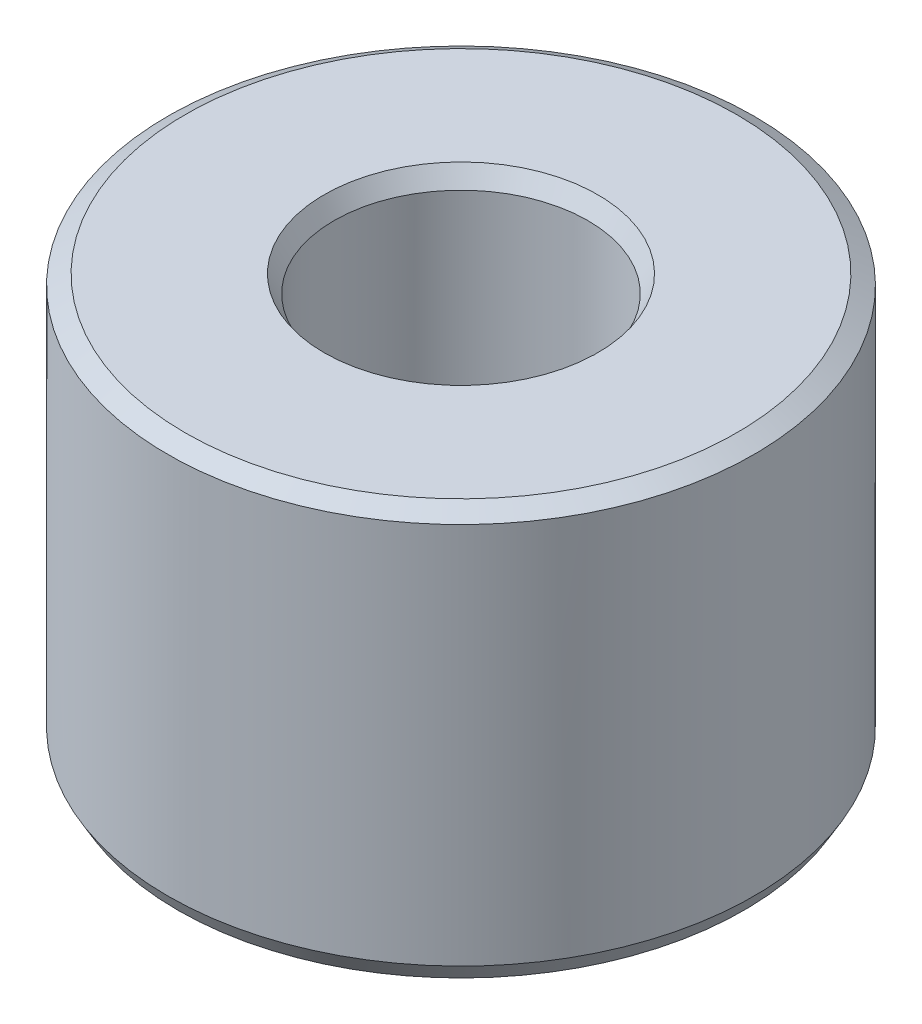
from build123d import *
from OCP.BRepFilletAPI import BRepFilletAPI_MakeChamfer

# Parameters (mm, degrees)
SKETCH1_R           = 55
BOSS_EXTRUDE1_DEPTH = 76.90319958
SKETCH2_R           = 23.805517129
CUT_EXTRUDE1_DEPTH  = 110.380538057
CHAMFER1_SIZE       = 1.880921056
CHAMFER1_SIZE2      = 3.257850834


with BuildPart() as part:
    # Sketch1 → Boss-Extrude1 (new body)
    with BuildSketch(Plane(origin=(0, 0, 0), x_dir=(1, 0, 0), z_dir=(0, 1, 0))):
        Circle(SKETCH1_R)
    extrude(amount=BOSS_EXTRUDE1_DEPTH)

    # Sketch2 → Cut-Extrude1 (cut, through all)
    with BuildSketch(Plane(origin=(0, 0, 0), x_dir=(1, 0, 0), z_dir=(0, 1, 0))):
        Circle(SKETCH2_R)
    extrude(amount=CUT_EXTRUDE1_DEPTH, mode=Mode.SUBTRACT)

    # Chamfer1: one chamfer whose edges measure the first distance from different faces: ONE call of the kernel's chamfer builder (chamfer() names one face for all edges)
    chamfer1_edges_1 = [part.edges().sort_by_distance(p)[0] for p in [
        (-23.805517129, 76.90319958, 0),
    ]]
    chamfer1_side_1 = [part.faces().sort_by_distance(p)[0] for p in [
        (-53.444365081, 76.90319958, 0),
    ]]
    chamfer1_edges_2 = [part.edges().sort_by_distance(p)[0] for p in [
        (-23.805517129, 0, 0),
    ]]
    chamfer1_side_2 = [part.faces().sort_by_distance(p)[0] for p in [
        (-23.805517129, 38.45159979, 0),
    ]]
    chamfer1_edges_3 = [part.edges().sort_by_distance(p)[0] for p in [
        (-55, 0, 0),
    ]]
    chamfer1_side_3 = [part.faces().sort_by_distance(p)[0] for p in [
        (-53.444365081, 0, 0),
    ]]
    chamfer1_edges_4 = [part.edges().sort_by_distance(p)[0] for p in [
        (-55, 76.90319958, 0),
    ]]
    chamfer1_side_4 = [part.faces().sort_by_distance(p)[0] for p in [
        (-55, 38.45159979, 0),
    ]]
    chamfer1 = BRepFilletAPI_MakeChamfer(part.part.solid().wrapped)
    for e in chamfer1_edges_1:
        chamfer1.Add(CHAMFER1_SIZE, CHAMFER1_SIZE2, e.wrapped, chamfer1_side_1[0].wrapped)  # the first distance lies on this face
    for e in chamfer1_edges_2:
        chamfer1.Add(CHAMFER1_SIZE, CHAMFER1_SIZE2, e.wrapped, chamfer1_side_2[0].wrapped)  # the first distance lies on this face
    for e in chamfer1_edges_3:
        chamfer1.Add(CHAMFER1_SIZE, CHAMFER1_SIZE2, e.wrapped, chamfer1_side_3[0].wrapped)  # the first distance lies on this face
    for e in chamfer1_edges_4:
        chamfer1.Add(CHAMFER1_SIZE, CHAMFER1_SIZE2, e.wrapped, chamfer1_side_4[0].wrapped)  # the first distance lies on this face
    add(Compound.cast(chamfer1.Shape()), mode=Mode.REPLACE)


solid = part.part
